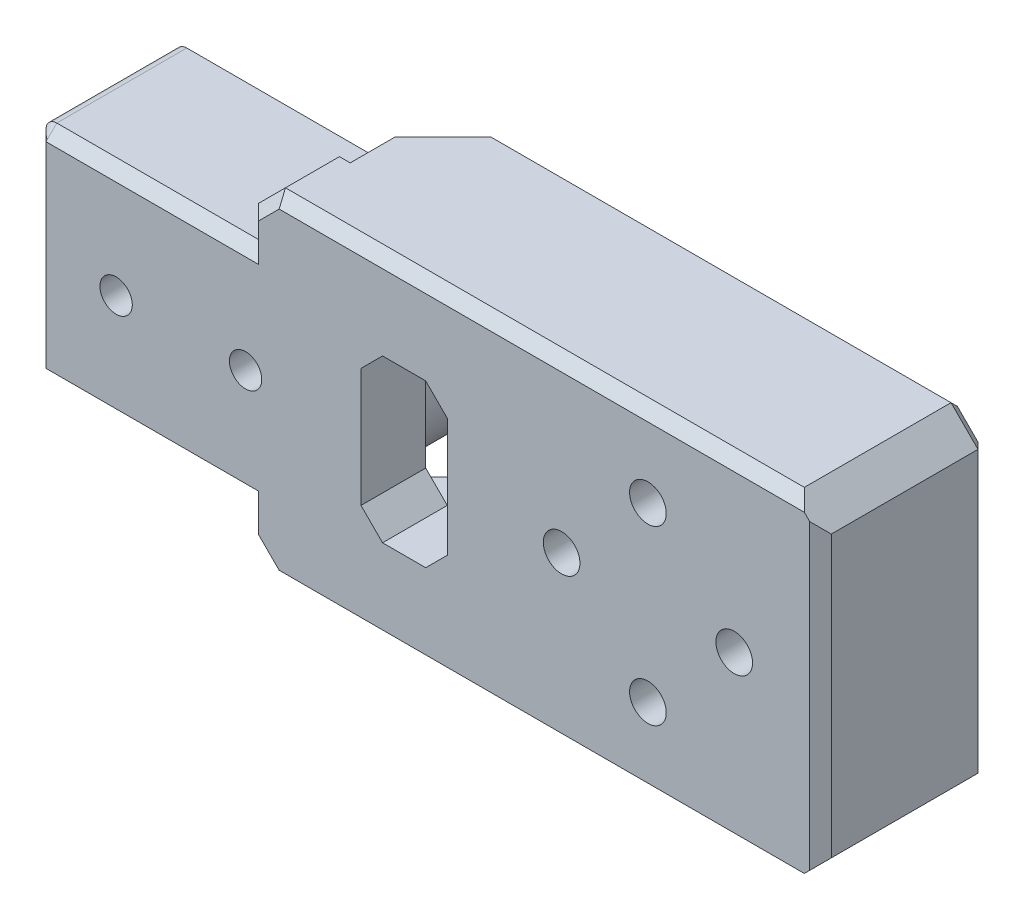
from build123d import *

# Parameters (mm, degrees)
BOSS_EXTRUDE1_DEPTH     = 11
CUT_EXTRUDE2_DEPTH      = 8.05
BOSS_EXTRUDE2_REACH     = 38.858
SKETCH4_W               = 2.5
SKETCH4_H               = 1.5
BOSS_EXTRUDE5_DEPTH     = 3.05
FILLET3_R               = 1
SKETCH8_R               = 1.7
BOSS_EXTRUDE3_DEPTH     = 6
CHAMFER1_SIZE           = 2.5
CUT_EXTRUDE5_REACH      = 80.439
SKETCH10_R              = 1.7
BOSS_EXTRUDE4_DEPTH     = 9.6
CHAMFER3_SIZE           = 5
CHAMFER2_SIZE           = 1
CUT_EXTRUDE6_DEPTH      = 78.764773516
CUT_EXTRUDE6_DEPTH_BACK = 78.764773516
SKETCH15_R              = 1.5
CUT_EXTRUDE7_DEPTH      = 79.438526886


with BuildPart() as part:
    # Sketch1 → Boss-Extrude1 (new body)
    with BuildSketch(Plane.XY):
        with BuildLine():
            Line((1, 0), (19.7, 0))
            ThreePointArc((19.7, 0), (29.8, 10.1), (19.7, 20.2))
            Line((19.7, 20.2), (1, 20.2))
            ThreePointArc((1, 20.2), (0.292893219, 19.907106781), (0, 19.2))
            Line((0, 19.2), (0, 1))
            ThreePointArc((0, 1), (0.292893219, 0.292893219), (1, 0))
        make_face()
    extrude(amount=BOSS_EXTRUDE1_DEPTH)

    # Sketch3 → Cut-Extrude2 (cut)
    with BuildSketch(Plane.XY.offset(11)):
        with BuildLine():
            Line((0, 16), (19.7, 16))
            ThreePointArc((19.7, 16), (25.6, 10.1), (19.7, 4.2))
            Line((19.7, 4.2), (0, 4.2))
            Line((0, 4.2), (0, 16))
        make_face()
    extrude(amount=-CUT_EXTRUDE2_DEPTH, mode=Mode.SUBTRACT)

    # Sketch4 → Boss-Extrude2 (add, up to next)
    with BuildSketch(Plane.ZY.offset(-1), mode=Mode.PRIVATE) as boss_extrude2_sk1:
        with Locations((6.95, 15.25)):
            Rectangle(SKETCH4_W, SKETCH4_H)
    boss_extrude2_tool1 = extrude(boss_extrude2_sk1.sketch, amount=-BOSS_EXTRUDE2_REACH, mode=Mode.PRIVATE) - part.part
    # Sketch4 → Boss-Extrude2 (add, up to next)
    with BuildSketch(Plane.ZY.offset(-1), mode=Mode.PRIVATE) as boss_extrude2_sk2:
        with Locations((6.95, 4.95)):
            Rectangle(SKETCH4_W, SKETCH4_H)
    boss_extrude2_tool2 = extrude(boss_extrude2_sk2.sketch, amount=-BOSS_EXTRUDE2_REACH, mode=Mode.PRIVATE) - part.part
    add(boss_extrude2_tool1.solids().sort_by_distance((1, 15.25, 6.95))[0])
    add(boss_extrude2_tool2.solids().sort_by_distance((1, 4.95, 6.95))[0])

    # Sketch14 → Boss-Extrude5 (add)
    with BuildSketch(Plane.XY.offset(11)):
        with BuildLine():
            Line((0, 19.2), (0, 1))
            ThreePointArc((0, 1), (0.292893219, 0.292893219), (1, 0))
            Line((1, 0), (19.7, 0))
            ThreePointArc((19.7, 0), (29.8, 10.1), (19.7, 20.2))
            Line((19.7, 20.2), (1, 20.2))
            ThreePointArc((1, 20.2), (0.292893219, 19.907106781), (0, 19.2))
        make_face()
    extrude(amount=BOSS_EXTRUDE5_DEPTH)

    # Fillet3
    fillet3_edges = [part.edges().sort_by_distance(p)[0] for p in [
        (1, 15.25, 5.7),
        (1, 14.5, 6.95),
        (1, 15.25, 8.2),
        (1, 4.95, 5.7),
        (1, 4.95, 8.2),
        (1, 5.7, 6.95),
    ]]
    fillet(fillet3_edges, radius=FILLET3_R)

    # Sketch8 → Boss-Extrude3 (add)
    with BuildSketch(Plane(origin=(0, 0, 14.05), x_dir=(-1, 0, 0), z_dir=(0, 0, -1))):
        with BuildLine():
            Line((-19.7, 25.6), (-72.8, 25.6))
            Line((-72.8, 25.6), (-72.8, -5.4))
            Line((-72.8, -5.4), (-19.7, -5.4))
            Line((-19.7, -5.4), (-19.7, 4.2))
            ThreePointArc((-19.7, 4.2), (-25.6, 10.1), (-19.7, 16))
            Line((-19.7, 16), (-19.7, 25.6))
        make_face()
        with Locations((-64.8, 10.1)):
            Circle(SKETCH8_R, mode=Mode.SUBTRACT)
        with Locations((-56.8, 2.1)):
            Circle(SKETCH8_R, mode=Mode.SUBTRACT)
        with Locations((-48.8, 10.1)):
            Circle(SKETCH8_R, mode=Mode.SUBTRACT)
        with Locations((-56.8, 18.1)):
            Circle(SKETCH8_R, mode=Mode.SUBTRACT)
    extrude(amount=BOSS_EXTRUDE3_DEPTH)

    # Chamfer1
    chamfer1_edges = [part.edges().sort_by_distance(p)[0] for p in [
        (19.7, -5.4, 11.05),
        (19.7, 25.6, 11.05),
        (72.8, 25.6, 11.05),
        (72.8, -5.4, 11.05),
    ]]
    chamfer(chamfer1_edges, length=CHAMFER1_SIZE)

    # Sketch10 → Cut-Extrude5 (cut, up to next)
    with BuildSketch(Plane(origin=(0, 0, 0), x_dir=(-1, 0, 0), z_dir=(0, 0, -1)), mode=Mode.PRIVATE) as cut_extrude5_sk1:
        with Locations((-7.5, 10.1)):
            Circle(SKETCH10_R)
    cut_extrude5_tool1 = extrude(cut_extrude5_sk1.sketch, amount=-CUT_EXTRUDE5_REACH, mode=Mode.PRIVATE) & part.part
    # Sketch10 → Cut-Extrude5 (cut, up to next)
    with BuildSketch(Plane(origin=(0, 0, 0), x_dir=(-1, 0, 0), z_dir=(0, 0, -1)), mode=Mode.PRIVATE) as cut_extrude5_sk2:
        with Locations((-19.5, 10.1)):
            Circle(SKETCH10_R)
    cut_extrude5_tool2 = extrude(cut_extrude5_sk2.sketch, amount=-CUT_EXTRUDE5_REACH, mode=Mode.PRIVATE) & part.part
    add(cut_extrude5_tool1.solids().sort_by_distance((7.5, 10.1, 0))[0], mode=Mode.SUBTRACT)
    add(cut_extrude5_tool2.solids().sort_by_distance((19.5, 10.1, 0))[0], mode=Mode.SUBTRACT)

    # Sketch11 → Boss-Extrude4 (add)
    with BuildSketch(Plane(origin=(0, 0, 8.05), x_dir=(-1, 0, 0), z_dir=(0, 0, -1))):
        Polygon((-22.2, 25.6), (-70.3, 25.6), (-72.8, 23.1), (-72.8, -2.9), (-70.3, -5.4), (-22.2, -5.4), (-22.2, -2.4), (-68.8, -2.4), (-69.8, -1.4), (-69.8, 21.6), (-68.8, 22.6), (-22.2, 22.6), align=None)
    extrude(amount=BOSS_EXTRUDE4_DEPTH)

    # Chamfer3
    chamfer3_edges = [part.edges().sort_by_distance(p)[0] for p in [
        (22.2, 24.1, -1.55),
        (22.2, -3.9, -1.55),
    ]]
    chamfer(chamfer3_edges, length=CHAMFER3_SIZE)

    # Chamfer2
    chamfer2_edges = [part.edges().sort_by_distance(p)[0] for p in [
        (48.75, 25.6, -1.55),
        (46.25, -5.4, 14.05),
        (72.8, 10.1, 14.05),
        (72.8, 10.1, -1.55),
        (46.25, 25.6, 14.05),
        (22.2, 25.6, 5.75),
        (22.2, -5.4, 5.75),
        (24.7, -5.4, 0.95),
        (24.7, 25.6, 0.95),
        (48.75, -5.4, -1.55),
        (71.55, -4.15, -1.55),
        (71.55, 24.35, -1.55),
        (10.35, 0, 0),
        (29.8, 10.1, 0),
        (10.35, 20.2, 0),
        (0.292893219, 19.907106781, 0),
        (0.292893219, 0.292893219, 0),
        (0, 10.1, 0),
        (0, 10.1, 14.05),
        (10.35, 0, 14.05),
        (19.7, -1.45, 14.05),
        (20.95, -4.15, 14.05),
        (0.292893219, 0.292893219, 14.05),
        (0.292893219, 19.907106781, 14.05),
        (10.35, 20.2, 14.05),
        (19.7, 21.65, 14.05),
        (20.95, 24.35, 14.05),
    ]]
    chamfer(chamfer2_edges, length=CHAMFER2_SIZE - 0.0001)  # a hair under: the kernel refuses the full size

    # Sketch12 → Cut-Extrude6 (cut, two sides: drawn at the far end of the back side and taken through both)
    with BuildSketch(Plane(origin=(0, 0, 8.05), x_dir=(-1, 0, 0), z_dir=(0, 0, -1)).offset(-CUT_EXTRUDE6_DEPTH_BACK)):
        Polygon((-38.2, 4.6), (-38.2, 15.6), (-36.2, 17.6), (-32.2, 17.6), (-30.2, 15.6), (-30.2, 4.6), (-32.2, 2.6), (-36.2, 2.6), align=None)
    extrude(amount=CUT_EXTRUDE6_DEPTH + CUT_EXTRUDE6_DEPTH_BACK, mode=Mode.SUBTRACT)

    # Sketch15 → Cut-Extrude7 (cut, through all)
    with BuildSketch(Plane(origin=(0, 0, 0), x_dir=(-1, 0, 0), z_dir=(0, 0, -1))):
        with Locations((-19.5, 10.1)):
            Circle(SKETCH15_R)
        with Locations((-7.5, 10.1)):
            Circle(SKETCH15_R)
    extrude(amount=-CUT_EXTRUDE7_DEPTH, mode=Mode.SUBTRACT)


solid = part.part
